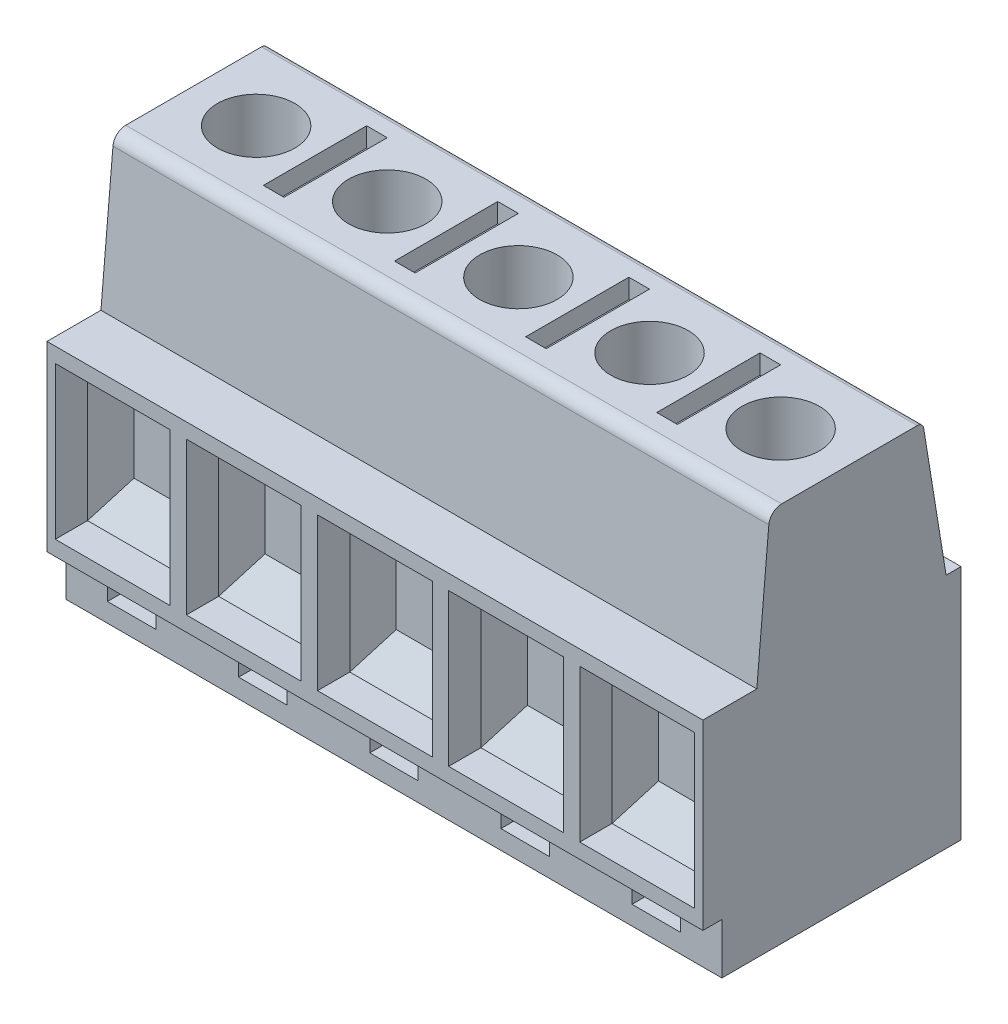
from build123d import *

# Parameters (mm, degrees)
BOSS_EXTRUDE1_DEPTH     = 10.16
SKETCH2_W               = 8.900000000000002
SKETCH2_H               = 11.800000000000011
CUT_EXTRUDE1_DEPTH      = 2.5
SKETCH5_R               = 2.9999999999999996
CUT_EXTRUDE2_DEPTH      = 5.7
SKETCH7_W               = 1.2999999999999998
SKETCH7_H               = 0.8000000000000007
SKETCH7_H_2             = 0.7999999999999936
BOSS_EXTRUDE2_DEPTH     = 4.5
CUT_EXTRUDE5_START      = -10.96
CUT_EXTRUDE5_DEPTH      = 10.96
SKETCH10_R              = 1.4999999999999998
CUT_EXTRUDE6_DEPTH      = 4.5
SKETCH13_W              = 3.75
SKETCH13_H              = 1
CUT_EXTRUDE8_DEPTH      = 3
FILLET3_R               = 0.5
FILLET4_R               = 1
SKETCH12_W              = 1.2999999999999998
SKETCH12_H              = 1.299999999999999
BOSS_EXTRUDE3_DEPTH     = 0.5
BOSS_EXTRUDE3_2_DEPTH   = 0.5
BOSS_EXTRUDE3_3_DEPTH   = 0.5
BOSS_EXTRUDE4_START     = 0.01
BOSS_EXTRUDE4_DEPTH     = 0.01
LPATTERN8_COUNT         = 5
LPATTERN8_PITCH         = 10.16
LPATTERN8_2_COUNT       = 5
LPATTERN8_2_PITCH       = 10.16
LPATTERN8_3_COUNT       = 5
LPATTERN8_3_PITCH       = 10.16
LPATTERN8_4_COUNT       = 5
LPATTERN8_4_PITCH       = 10.16
FILLET3_OF_LPATTERN8_R  = 0.5
FILLET4_OF_LPATTERN8_R  = 1
SKETCH11_W              = 1.6
SKETCH11_H              = 8
CUT_EXTRUDE7_DEPTH      = 1.5
LPATTERN9_START         = 57.041856165
LPATTERN9_OUTLINE_W     = 1.5999999999999979
LPATTERN9_OUTLINE_H     = 8
LPATTERN9_OUTLINE_W_2   = 1.6000000000000014
LPATTERN9_DEPTH         = 1.5
LPATTERN9_START_2       = 28.541856165
LPATTERN9_2_OUTLINE_W   = 1.2999999999999972
LPATTERN9_2_OUTLINE_H   = 1.299999999999999
LPATTERN9_2_OUTLINE_W_2 = 1.3000000000000007
LPATTERN9_2_OUTLINE_H_2 = 1.2999999999999972
LPATTERN9_2_OUTLINE_H_3 = 1.3000000000000007
LPATTERN9_2_DEPTH       = 0.5
BOSS_EXTRUDE6_DEPTH     = 0.01


# Read off the part's stored shape, not the designer's step: Cut-Extrude5, LPattern9
with BuildPart() as part:
    # Sketch1 → Boss-Extrude1 (new body)
    with BuildSketch(Plane(origin=(0, 0, 0), x_dir=(0, 0, -1), z_dir=(1, 0, 0))):
        Polygon((9.669213470381848, 32.96915259715871), (9.669213470381848, 47.08678337249189), (13.847501539912686, 47.08678337249189), (14.859335014289963, 58.54185616450892), (26.70903057031256, 58.54185616450892), (28.514863984729242, 47.38649061080074), (29.669213470381848, 47.38649061080074), (29.66921347038185, 29.041856164508925), (11.142277404209432, 29.04185616450892), (11.142277404209432, 32.96915259715871), align=None)
    boss_extrude1 = extrude(amount=BOSS_EXTRUDE1_DEPTH)

    # Sketch2 → Cut-Extrude1 (cut)
    with BuildSketch(Plane.XY.offset(-9.669213470381848)):
        with Locations((5.08, 40.0279679848253)):
            Rectangle(SKETCH2_W, SKETCH2_H)
    cut_extrude1 = extrude(amount=-CUT_EXTRUDE1_DEPTH, mode=Mode.SUBTRACT)

    # Sketch3 → Cut-Loft1 section 0
    with BuildSketch(Plane.XY.offset(-12.169213470381848)):
        with BuildLine():
            Line((9.530000000000001, 34.1279679848253), (9.530000000000001, 45.92796798482531))
            Line((9.530000000000001, 45.92796798482531), (0.6299999999999994, 45.92796798482531))
            Line((0.6299999999999994, 45.92796798482531), (0.6299999999999994, 34.1279679848253))
            Line((0.6299999999999994, 34.1279679848253), (9.530000000000001, 34.1279679848253))
        make_face()
    # Sketch4 → Cut-Loft1 section 1
    with BuildSketch(Plane.XY.offset(-14.069213470381849)):
        with BuildLine():
            Line((2.3299999999999987, 36.877967984825304), (7.829999999999998, 36.877967984825304))
            Line((7.829999999999998, 36.877967984825304), (7.829999999999998, 43.1779679848253))
            Line((7.829999999999998, 43.1779679848253), (2.3299999999999987, 43.1779679848253))
            Line((2.3299999999999987, 43.1779679848253), (2.3299999999999987, 36.877967984825304))
        make_face()
    cut_loft1 = loft(mode=Mode.SUBTRACT)

    # Sketch5 → Cut-Extrude2 (cut)
    with BuildSketch(Plane(origin=(0, 58.54185616450892, 0), x_dir=(1, 0, 0), z_dir=(0, 1, 0))):
        with Locations(Location((5.08, 20.784182792301262, 0), (0, 0, 270))):
            Circle(SKETCH5_R)
    cut_extrude2 = extrude(amount=-CUT_EXTRUDE2_DEPTH, mode=Mode.SUBTRACT)

    # Sketch7 → Boss-Extrude2 (add)
    with BuildSketch(Plane.XZ.offset(-29.041856164508918)):
        with Locations((5.08, -27.169213470381862)):
            Rectangle(SKETCH7_W, SKETCH7_H)
        with Locations((5.08, -17.00921347038186)):
            Rectangle(SKETCH7_W, SKETCH7_H_2)
    boss_extrude2 = extrude(amount=BOSS_EXTRUDE2_DEPTH)

    # Cut-Extrude5 outline → Cut-Extrude5 (cut)
    with BuildSketch(Plane.XY.offset(-16.60921347038186).offset(CUT_EXTRUDE5_START)):
        with BuildLine():
            Line((5.73, 24.541856165), (5.73, 25.191856165))
            ThreePointArc((5.73, 25.191856165), (5.539619408, 24.732236757), (5.08, 24.541856165))
            Line((5.08, 24.541856165), (5.73, 24.541856165))
        make_face()
        with BuildLine():
            Line((4.43, 24.541856165), (5.08, 24.541856165))
            ThreePointArc((5.08, 24.541856165), (4.620380592, 24.732236757), (4.43, 25.191856165))
            Line((4.43, 25.191856165), (4.43, 24.541856165))
        make_face()
    cut_extrude5 = extrude(amount=CUT_EXTRUDE5_DEPTH, mode=Mode.SUBTRACT)

    # Sketch10 → Cut-Extrude6 (cut)
    with BuildSketch(Plane(origin=(0, 38.527852040591384, -38.527852040591256), x_dir=(-1, 0, 0), z_dir=(0, 0.7071067811865488, -0.7071067811865464))):
        with Locations(Location((-5.08, 12.528006810151506, 0), (0, 0, 90))):
            Circle(SKETCH10_R)
    cut_extrude6 = extrude(amount=-CUT_EXTRUDE6_DEPTH, mode=Mode.SUBTRACT)

    # Sketch13 → Cut-Extrude8 (cut)
    with BuildSketch(Plane.XY.offset(-11.142277404209432)):
        with Locations((5.080000000000007, 31.005504380833823)):
            Rectangle(SKETCH13_W, SKETCH13_H)
    cut_extrude8 = extrude(amount=-CUT_EXTRUDE8_DEPTH, mode=Mode.SUBTRACT)

    # Fillet3
    fillet3_edges = [part.edges().sort_by_distance(p)[0] for p in [
        (5.08, 58.54185616450892, -26.70903057031256),
    ]]
    fillet(fillet3_edges, radius=FILLET3_R)

    # Fillet4
    fillet4_edges = [part.edges().sort_by_distance(p)[0] for p in [
        (5.08, 58.54185616450892, -14.859335014289963),
    ]]
    fillet(fillet4_edges, radius=FILLET4_R)

    # Sketch14 → Boss-Extrude4 (add)
    with BuildSketch(Plane(origin=(10.16, 0, 0), x_dir=(0, 0, -1), z_dir=(1, 0, 0)).offset(BOSS_EXTRUDE4_START)):
        with BuildLine():
            Line((14.77877644669124, 57.629844179105966), (13.847501539912686, 47.08678337249189))
            Line((13.847501539912686, 47.08678337249189), (9.669213470381848, 47.08678337249189))
            Line((9.669213470381848, 47.08678337249189), (9.669213470381848, 32.96915259715871))
            Line((9.669213470381848, 32.96915259715871), (11.142277404209432, 32.96915259715871))
            Line((11.142277404209432, 32.96915259715871), (11.142277404209432, 29.04185616450892))
            Line((11.142277404209432, 29.04185616450892), (29.66921347038185, 29.041856164508925))
            Line((29.66921347038185, 29.041856164508925), (29.669213470381848, 47.38649061080074))
            Line((29.669213470381848, 47.38649061080074), (28.514863984729242, 47.38649061080074))
            Line((28.514863984729242, 47.38649061080074), (26.777036465378647, 58.121756163471794))
            ThreePointArc((26.777036465378647, 58.121756163471794), (26.607537368480997, 58.42261199143836), (26.28346175961899, 58.54185616450892))
            Line((26.28346175961899, 58.54185616450892), (15.77489798008326, 58.54185616450892))
            ThreePointArc((15.77489798008326, 58.54185616450892), (15.09961582223998, 58.279415658582806), (14.77877644669124, 57.629844179105966))
        make_face()
    extrude(amount=-BOSS_EXTRUDE4_DEPTH)



with BuildPart() as body_2:
    # Sketch12 → Boss-Extrude3 (new body)
    with BuildSketch(Plane.XZ.offset(-29.041856164508918)):
        with Locations((3.9e-16, -15.192277404209438)):
            Rectangle(SKETCH12_W, SKETCH12_H)
    extrude(amount=BOSS_EXTRUDE3_DEPTH)


with BuildPart() as body_3:
    # Sketch12 → Boss-Extrude3 2 (new body)
    with BuildSketch(Plane.XZ.offset(-29.041856164508918)):
        Polygon((-0.6500000000000012, -20.342277404209444), (0.6499999999999989, -20.342277404209444), (0.649999999999998, -19.04227740420944), (-0.6500000000000012, -19.04227740420944), align=None)
    extrude(amount=BOSS_EXTRUDE3_2_DEPTH)


with BuildPart() as body_4:
    # Sketch12 → Boss-Extrude3 3 (new body)
    with BuildSketch(Plane.XZ.offset(-29.041856164508918)):
        Polygon((-0.6499999999999996, -25.042277404209447), (0.6500000000000006, -25.042277404209447), (0.6500000000000008, -23.742277404209442), (-0.6499999999999996, -23.742277404209442), align=None)
    extrude(amount=BOSS_EXTRUDE3_3_DEPTH)


with BuildPart() as part_1:
    add(part.part)

    add(body_2.part)  # LPattern8 merges body 2

    add(body_3.part)  # LPattern8 merges body 3

    add(body_4.part)  # LPattern8 merges body 4
    # LPattern8: Boss-Extrude1 ×5
    with Locations(*[(-i * LPATTERN8_PITCH, 0, 0) for i in range(1, LPATTERN8_COUNT)]):
        add(boss_extrude1)

    # LPattern8 2: Cut-Extrude1, Cut-Loft1, Cut-Extrude2 ×5
    with Locations(*[(-i * LPATTERN8_2_PITCH, 0, 0) for i in range(1, LPATTERN8_2_COUNT)]):
        add(cut_extrude1, mode=Mode.SUBTRACT)
        add(cut_loft1, mode=Mode.SUBTRACT)
        add(cut_extrude2, mode=Mode.SUBTRACT)

    # LPattern8 3: Boss-Extrude2 ×5
    with Locations(*[(-i * LPATTERN8_3_PITCH, 0, 0) for i in range(1, LPATTERN8_3_COUNT)]):
        add(boss_extrude2)

    # LPattern8 4: Cut-Extrude5, Cut-Extrude6, Cut-Extrude8 ×5
    with Locations(*[(-i * LPATTERN8_4_PITCH, 0, 0) for i in range(1, LPATTERN8_4_COUNT)]):
        add(cut_extrude5, mode=Mode.SUBTRACT)
        add(cut_extrude6, mode=Mode.SUBTRACT)
        add(cut_extrude8, mode=Mode.SUBTRACT)

    # Fillet3 of LPattern8
    fillet3_of_lpattern8_edges = [part_1.edges().sort_by_distance(p)[0] for p in [
        (-5.08, 58.54185616450892, -26.70903057031256),
        (-15.24, 58.54185616450892, -26.70903057031256),
        (-25.4, 58.54185616450892, -26.70903057031256),
        (-35.56, 58.54185616450892, -26.70903057031256),
    ]]
    fillet(fillet3_of_lpattern8_edges, radius=FILLET3_OF_LPATTERN8_R)

    # Fillet4 of LPattern8
    fillet4_of_lpattern8_edges = [part_1.edges().sort_by_distance(p)[0] for p in [
        (-5.08, 58.54185616450892, -14.859335014289963),
        (-15.24, 58.54185616450892, -14.859335014289963),
        (-25.4, 58.54185616450892, -14.859335014289963),
        (-35.56, 58.54185616450892, -14.859335014289963),
    ]]
    fillet(fillet4_of_lpattern8_edges, radius=FILLET4_OF_LPATTERN8_R)

    # Sketch11 → Cut-Extrude7 (cut)
    with BuildSketch(Plane(origin=(0, 58.54185616450892, 0), x_dir=(1, 0, 0), z_dir=(0, 1, 0))):
        with Locations((4.16e-15, 21.064117563348077)):
            Rectangle(SKETCH11_W, SKETCH11_H)
    extrude(amount=-CUT_EXTRUDE7_DEPTH, mode=Mode.SUBTRACT)

    # LPattern9 outline → LPattern9 (cut)
    with BuildSketch(Plane(origin=(0, 0, 0), x_dir=(1, 0, 0), z_dir=(0, 1, 0)).offset(LPATTERN9_START)):
        with Locations((-30.480000000000004, 21.064117563)):
            Rectangle(LPATTERN9_OUTLINE_W, LPATTERN9_OUTLINE_H)
        with Locations((-20.32, 21.064117563)):
            Rectangle(LPATTERN9_OUTLINE_W_2, LPATTERN9_OUTLINE_H)
        with Locations((-10.16, 21.064117563)):
            Rectangle(LPATTERN9_OUTLINE_W_2, LPATTERN9_OUTLINE_H)
    extrude(amount=LPATTERN9_DEPTH, mode=Mode.SUBTRACT)

    # LPattern9 2 outline → LPattern9 2 (add)
    with BuildSketch(Plane(origin=(0, 0, 0), x_dir=(1, 0, 0), z_dir=(0, 1, 0)).offset(LPATTERN9_START_2)):
        with Locations((-30.479999999999997, 15.192277404000002)):
            Rectangle(LPATTERN9_2_OUTLINE_W, LPATTERN9_2_OUTLINE_H)
        with Locations((-20.32, 15.192277404000002)):
            Rectangle(LPATTERN9_2_OUTLINE_W, LPATTERN9_2_OUTLINE_H)
        with Locations((-10.16, 15.192277404000002)):
            Rectangle(LPATTERN9_2_OUTLINE_W_2, LPATTERN9_2_OUTLINE_H)
        with Locations((-30.479999999999997, 24.392277404)):
            Rectangle(LPATTERN9_2_OUTLINE_W, LPATTERN9_2_OUTLINE_H_2)
        with Locations((-30.479999999999997, 19.692277404000002)):
            Rectangle(LPATTERN9_2_OUTLINE_W, LPATTERN9_2_OUTLINE_H_3)
        with Locations((-20.32, 24.392277404)):
            Rectangle(LPATTERN9_2_OUTLINE_W, LPATTERN9_2_OUTLINE_H_2)
        with Locations((-20.32, 19.692277404000002)):
            Rectangle(LPATTERN9_2_OUTLINE_W, LPATTERN9_2_OUTLINE_H_3)
        with Locations((-10.16, 24.392277404)):
            Rectangle(LPATTERN9_2_OUTLINE_W_2, LPATTERN9_2_OUTLINE_H_2)
        with Locations((-10.16, 19.692277404000002)):
            Rectangle(LPATTERN9_2_OUTLINE_W_2, LPATTERN9_2_OUTLINE_H_3)
    extrude(amount=LPATTERN9_2_DEPTH)

    # Sketch16 → Boss-Extrude6 (add)
    with BuildSketch(Plane.ZY.offset(40.64)):
        with BuildLine():
            Line((-13.847501539912686, 47.08678337249189), (-14.77877644669124, 57.629844179105966))
            ThreePointArc((-14.77877644669124, 57.629844179105966), (-15.09961582223998, 58.279415658582806), (-15.77489798008326, 58.54185616450892))
            Line((-15.77489798008326, 58.54185616450892), (-26.28346175961899, 58.54185616450892))
            ThreePointArc((-26.28346175961899, 58.54185616450892), (-26.607537368480997, 58.42261199143836), (-26.777036465378647, 58.121756163471794))
            Line((-26.777036465378647, 58.121756163471794), (-28.514863984729242, 47.38649061080074))
            Line((-28.514863984729242, 47.38649061080074), (-29.669213470381848, 47.38649061080074))
            Line((-29.669213470381848, 47.38649061080074), (-29.66921347038185, 29.041856164508925))
            Line((-29.66921347038185, 29.041856164508925), (-11.142277404209432, 29.04185616450892))
            Line((-11.142277404209432, 29.04185616450892), (-11.142277404209432, 32.96915259715871))
            Line((-11.142277404209432, 32.96915259715871), (-9.669213470381848, 32.96915259715871))
            Line((-9.669213470381848, 32.96915259715871), (-9.669213470381848, 47.08678337249189))
            Line((-9.669213470381848, 47.08678337249189), (-13.847501539912686, 47.08678337249189))
        make_face()
    extrude(amount=BOSS_EXTRUDE6_DEPTH)


solid = part_1.part
